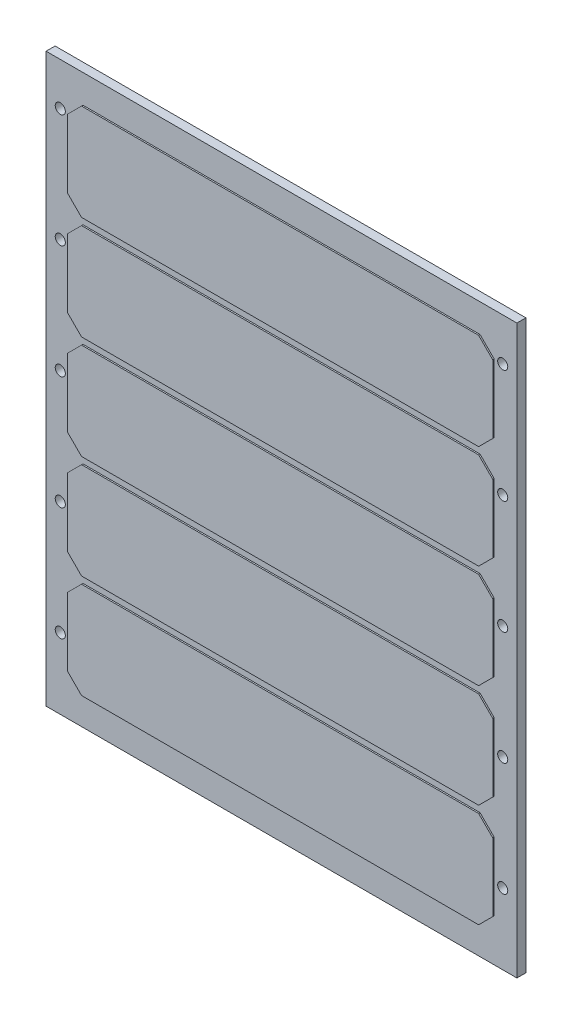
from build123d import *

# Parameters (mm, degrees)
SKETCH1_W                 = 83
SKETCH1_H                 = 100
BOSS_EXTRUDE1_DEPTH       = 1.5875
BOSS_EXTRUDE2_DEPTH       = 0.25
F_0_CLEARANCE_HOLE1_D     = 1.778
F_0_CLEARANCE_HOLE1_DEPTH = 3.175
F_0_CLEARANCE_HOLE1_TIP   = 0.53416509


with BuildPart() as part:
    # Sketch1 → Boss-Extrude1 (new body)
    with BuildSketch(Plane.XY):
        Rectangle(SKETCH1_W, SKETCH1_H)
    extrude(amount=BOSS_EXTRUDE1_DEPTH)

    # Sketch2 → Boss-Extrude2 (add)
    with BuildSketch(Plane.XY.offset(1.5875)):
        Polygon((-35, 45), (35, 45), (37.5, 42.5), (37.5, 30.5), (35, 28), (-35, 28), (-37.5, 30.5), (-37.5, 42.5), align=None)
        Polygon((-35, 26.75), (35, 26.75), (37.5, 24.25), (37.5, 12.25), (35, 9.75), (-35, 9.75), (-37.5, 12.25), (-37.5, 24.25), align=None)
        Polygon((-35, 8.5), (35, 8.5), (37.5, 6), (37.5, -6), (35, -8.5), (-35, -8.5), (-37.5, -6), (-37.5, 6), align=None)
        Polygon((-35, -9.75), (35, -9.75), (37.5, -12.25), (37.5, -24.25), (35, -26.75), (-35, -26.75), (-37.5, -24.25), (-37.5, -12.25), align=None)
        Polygon((-35, -28), (35, -28), (37.5, -30.5), (37.5, -42.5), (35, -45), (-35, -45), (-37.5, -42.5), (-37.5, -30.5), align=None)
    extrude(amount=BOSS_EXTRUDE2_DEPTH)

    # #0 Clearance Hole1
    with Locations(Plane.XY.offset(1.5875)):
        with Locations((-39, 42.5), (-39, 22.5), (-39, 2.5), (-39, -17.5), (-39, -37.5), (39, -37.5), (39, -17.5), (39, 2.5), (39, 22.5), (39, 42.5)):
            Hole(F_0_CLEARANCE_HOLE1_D / 2, depth=F_0_CLEARANCE_HOLE1_DEPTH)
            with Locations((0, 0, -(F_0_CLEARANCE_HOLE1_DEPTH + F_0_CLEARANCE_HOLE1_TIP / 2))):  # 118° drill point
                Cone(0, F_0_CLEARANCE_HOLE1_D / 2, F_0_CLEARANCE_HOLE1_TIP, mode=Mode.SUBTRACT)


solid = part.part
